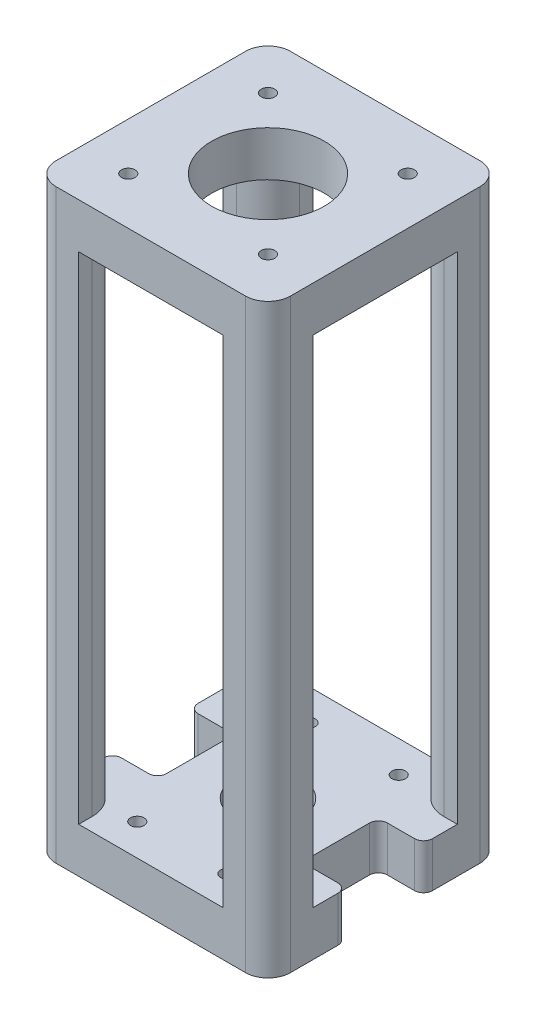
from build123d import *

# Parameters (mm, degrees)
SKETCH1_W           = 52
SKETCH1_H           = 52
BOSS_EXTRUDE1_DEPTH = 10
SKETCH2_W           = 10
SKETCH2_H           = 10
BOSS_EXTRUDE2_DEPTH = 110
SKETCH3_W           = 52
SKETCH3_H           = 52
BOSS_EXTRUDE3_DEPTH = 10
SKETCH4_R           = 12.5
CUT_EXTRUDE1_DEPTH  = 10
SKETCH5_R           = 7.5
CUT_EXTRUDE2_DEPTH  = 10
SKETCH6_W           = 10
SKETCH6_H           = 17
CUT_EXTRUDE3_DEPTH  = 10
SKETCH7_R           = 1.5
CUT_EXTRUDE4_DEPTH  = 10
FILLET1_R           = 5
FILLET2_R           = 2
SKETCH8_R           = 1.5
CUT_EXTRUDE6_DEPTH  = 10
FILLET4_R           = 7


with BuildPart() as part:
    # Sketch1 → Boss-Extrude1 (new body)
    with BuildSketch(Plane(origin=(0, 0, 0), x_dir=(1, 0, 0), z_dir=(0, 1, 0))):
        Rectangle(SKETCH1_W, SKETCH1_H)
    extrude(amount=BOSS_EXTRUDE1_DEPTH)

    # Sketch2 → Boss-Extrude2 (add)
    with BuildSketch(Plane(origin=(0, 10, 0), x_dir=(1, 0, 0), z_dir=(0, 1, 0))):
        with Locations((-21, 21)):
            Rectangle(SKETCH2_W, SKETCH2_H)
        with Locations((21, 21)):
            Rectangle(SKETCH2_W, SKETCH2_H)
        with Locations((-21, -21)):
            Rectangle(SKETCH2_W, SKETCH2_H)
        with Locations((21, -21)):
            Rectangle(SKETCH2_W, SKETCH2_H)
    extrude(amount=BOSS_EXTRUDE2_DEPTH)

    # Sketch3 → Boss-Extrude3 (add)
    with BuildSketch(Plane(origin=(0, 120, 0), x_dir=(1, 0, 0), z_dir=(0, 1, 0))):
        Rectangle(SKETCH3_W, SKETCH3_H)
    extrude(amount=BOSS_EXTRUDE3_DEPTH)

    # Sketch4 → Cut-Extrude1 (cut)
    with BuildSketch(Plane(origin=(0, 130, 0), x_dir=(1, 0, 0), z_dir=(0, 1, 0))):
        with Locations(Location((0, 0, 0), (0, 0, 270))):
            Circle(SKETCH4_R)
    extrude(amount=-CUT_EXTRUDE1_DEPTH, mode=Mode.SUBTRACT)

    # Sketch5 → Cut-Extrude2 (cut)
    with BuildSketch(Plane.XZ):
        with Locations(Location((0, 0, 0), (0, 0, 270))):
            Circle(SKETCH5_R)
    extrude(amount=-CUT_EXTRUDE2_DEPTH, mode=Mode.SUBTRACT)

    # Sketch6 → Cut-Extrude3 (cut)
    with BuildSketch(Plane.XZ):
        with Locations((-21, 0)):
            Rectangle(SKETCH6_W, SKETCH6_H)
        with Locations((21, 0)):
            Rectangle(SKETCH6_W, SKETCH6_H)
    extrude(amount=-CUT_EXTRUDE3_DEPTH, mode=Mode.SUBTRACT)

    # Sketch7 → Cut-Extrude4 (cut)
    with BuildSketch(Plane.XZ):
        with Locations(Location((10, 19, 0), (0, 0, 270))):
            Circle(SKETCH7_R)
        with Locations(Location((-10, 19, 0), (0, 0, 90))):
            Circle(SKETCH7_R)
        with Locations(Location((10, -19, 0), (0, 0, 90))):
            Circle(SKETCH7_R)
        with Locations(Location((-10, -19, 0), (0, 0, 270))):
            Circle(SKETCH7_R)
    extrude(amount=-CUT_EXTRUDE4_DEPTH, mode=Mode.SUBTRACT)

    # Fillet1
    fillet1_edges = [part.edges().sort_by_distance(p)[0] for p in [
        (26, 65, 26),
        (-26, 65, 26),
        (-26, 65, -26),
        (26, 65, -26),
    ]]
    fillet(fillet1_edges, radius=FILLET1_R)

    # Fillet2
    fillet2_edges = [part.edges().sort_by_distance(p)[0] for p in [
        (-16, 5, -8.5),
        (-16, 5, 8.5),
        (-26, 5, 8.5),
        (-26, 5, -8.5),
        (16, 5, 8.5),
        (16, 5, -8.5),
        (26, 5, -8.5),
        (26, 5, 8.5),
    ]]
    fillet(fillet2_edges, radius=FILLET2_R)

    # Sketch8 → Cut-Extrude6 (cut)
    with BuildSketch(Plane(origin=(0, 130, 0), x_dir=(1, 0, 0), z_dir=(0, 1, 0))):
        with Locations(Location((-15.5, -15.5, 0), (0, 0, 270))):
            Circle(SKETCH8_R)
        with Locations(Location((-15.5, 15.5, 0), (0, 0, 270))):
            Circle(SKETCH8_R)
        with Locations(Location((15.5, 15.5, 0), (0, 0, 270))):
            Circle(SKETCH8_R)
        with Locations(Location((15.5, -15.5, 0), (0, 0, 270))):
            Circle(SKETCH8_R)
    extrude(amount=-CUT_EXTRUDE6_DEPTH, mode=Mode.SUBTRACT)

    # Fillet4
    # the kernel refuses this fillet: 7 mm, written as the material it takes off along each edge
    with BuildSketch(Plane(origin=(-16, 10, -16), x_dir=(-1, 0, 0), z_dir=(0, 1, 0)), Plane(origin=(16, 10, -16), x_dir=(0, 0, -1), z_dir=(0, 1, 0)), Plane(origin=(16, 10, 16), x_dir=(1, 0, 0), z_dir=(0, 1, 0))) as fillet4_piece_1:
        with BuildLine():
            CenterArc((FILLET4_R, -FILLET4_R), FILLET4_R, 90, 90)
            Line((0, -FILLET4_R), (0, 0))
            Line((0, 0), (FILLET4_R, 0))
        make_face()
    extrude(amount=110, mode=Mode.SUBTRACT)
    with BuildSketch(Plane(origin=(-16, 10, 16), x_dir=(-1, 0, 0), z_dir=(0, 1, 0))) as fillet4_piece_2:
        with BuildLine():
            CenterArc((FILLET4_R, FILLET4_R), FILLET4_R, 180, 90)
            Line((0, FILLET4_R), (0, 0))
            Line((0, 0), (FILLET4_R, 0))
        make_face()
    extrude(amount=110, mode=Mode.SUBTRACT)


solid = part.part
